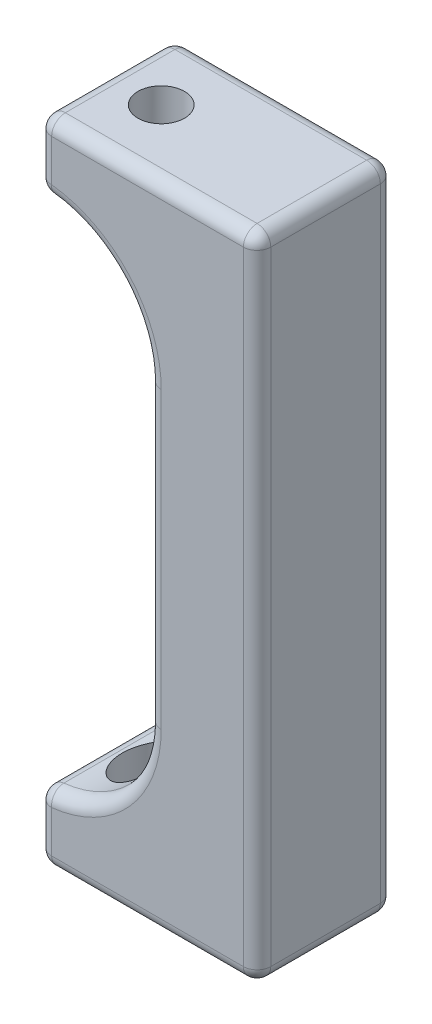
from build123d import *

# Parameters (mm, degrees)
SKETCH1_W               = 8
SKETCH1_H               = 5
SKETCH1_H_2             = 47.5
BOSS_EXTRUDE1_DEPTH     = 10
SKETCH2_R               = 1.7
CUT_EXTRUDE1_DEPTH      = 51.002499938
CUT_EXTRUDE2_DEPTH      = 40
CUT_EXTRUDE2_DEPTH_BACK = 2.5
SKETCH3_R               = 2.85
FILLET1_R               = 8
FILLET2_R               = 1


with BuildPart() as part:
    # Sketch1 → Boss-Extrude1 (new body)
    with BuildSketch(Plane.XY):
        with Locations((-8, 21.25)):
            Rectangle(SKETCH1_W, SKETCH1_H)
        Rectangle(SKETCH1_W, SKETCH1_H_2)
        with Locations((-8, -21.25)):
            Rectangle(SKETCH1_W, SKETCH1_H)
    extrude(amount=BOSS_EXTRUDE1_DEPTH)

    # Sketch2 → Cut-Extrude1 (cut, through all)
    with BuildSketch(Plane(origin=(0, 23.75, 0), x_dir=(1, 0, 0), z_dir=(0, 1, 0))):
        with Locations(Location((-8, -5, 0), (0, 0, 270))):
            Circle(SKETCH2_R)
    extrude(amount=-CUT_EXTRUDE1_DEPTH, mode=Mode.SUBTRACT)

    # Sketch3 → Cut-Extrude2 (cut, two sides: drawn at the far end of the back side and taken through both)
    with BuildSketch(Plane(origin=(0, -18.75, 0), x_dir=(1, 0, 0), z_dir=(0, 1, 0)).offset(-CUT_EXTRUDE2_DEPTH_BACK)):
        with Locations((-8, -5)):
            Circle(SKETCH3_R)
    extrude(amount=CUT_EXTRUDE2_DEPTH + CUT_EXTRUDE2_DEPTH_BACK, mode=Mode.SUBTRACT)

    # Fillet1
    # the kernel refuses this fillet: 8 mm, written as the material it adds along each edge
    with BuildSketch(Plane(origin=(-4, 18.75, 0), x_dir=(-1, 0, 0), z_dir=(0, 0, 1))) as fillet1_piece_1_section:
        with BuildLine():
            CenterArc((FILLET1_R, FILLET1_R), FILLET1_R, 180, 90)
            Line((0, FILLET1_R), (0, 0))
            Line((0, 0), (FILLET1_R, 0))
        make_face()
    fillet1_piece_1 = extrude(amount=10, mode=Mode.PRIVATE)
    fillet1_piece_1 = fillet1_piece_1 - Plane(origin=(-8, 18.525887701, 5), x_dir=(1, 0, 0), z_dir=(0, -1, 0)) * Cylinder(2.85, 53, mode=Mode.PRIVATE)
    add(fillet1_piece_1)
    with BuildSketch(Plane(origin=(-4, -18.75, 0), x_dir=(0, 1, 0), z_dir=(0, 0, 1))) as fillet1_piece_2_section:
        with BuildLine():
            CenterArc((FILLET1_R, FILLET1_R), FILLET1_R, 180, 90)
            Line((0, FILLET1_R), (0, 0))
            Line((0, 0), (FILLET1_R, 0))
        make_face()
    fillet1_piece_2 = extrude(amount=10, mode=Mode.PRIVATE)
    fillet1_piece_2 = fillet1_piece_2 - Plane(origin=(-8, -12.833542895, 5), x_dir=(1, 0, 0), z_dir=(0, 1, 0)) * Cylinder(2.85, 53, mode=Mode.PRIVATE)
    add(fillet1_piece_2)

    # Fillet2
    fillet2_edges = [part.edges().sort_by_distance(p)[0] for p in [
        (4, 0, 0),
        (-4, -23.75, 0),
        (-12, -21.25, 0),
        (-12, 21.25, 10),
        (-12, 21.25, 0),
        (-4, 23.75, 0),
        (4, 23.75, 5),
        (4, -23.75, 5),
        (-12, -23.75, 5),
        (-12, -18.75, 5),
        (-12, 18.75, 5),
        (-12, 23.75, 5),
        (-12, -21.25, 10),
        (-4, -23.75, 10),
        (4, 0, 10),
        (-4, 23.75, 10),
        (-4, 0, 0),
        (-4, 0, 10),
        (-6.343145751, 16.406854249, 0),
        (-6.343145751, 16.406854249, 10),
        (-6.343145751, -16.406854249, 0),
        (-6.343145751, -16.406854249, 10),
    ]]
    fillet(fillet2_edges, radius=FILLET2_R)


solid = part.part
